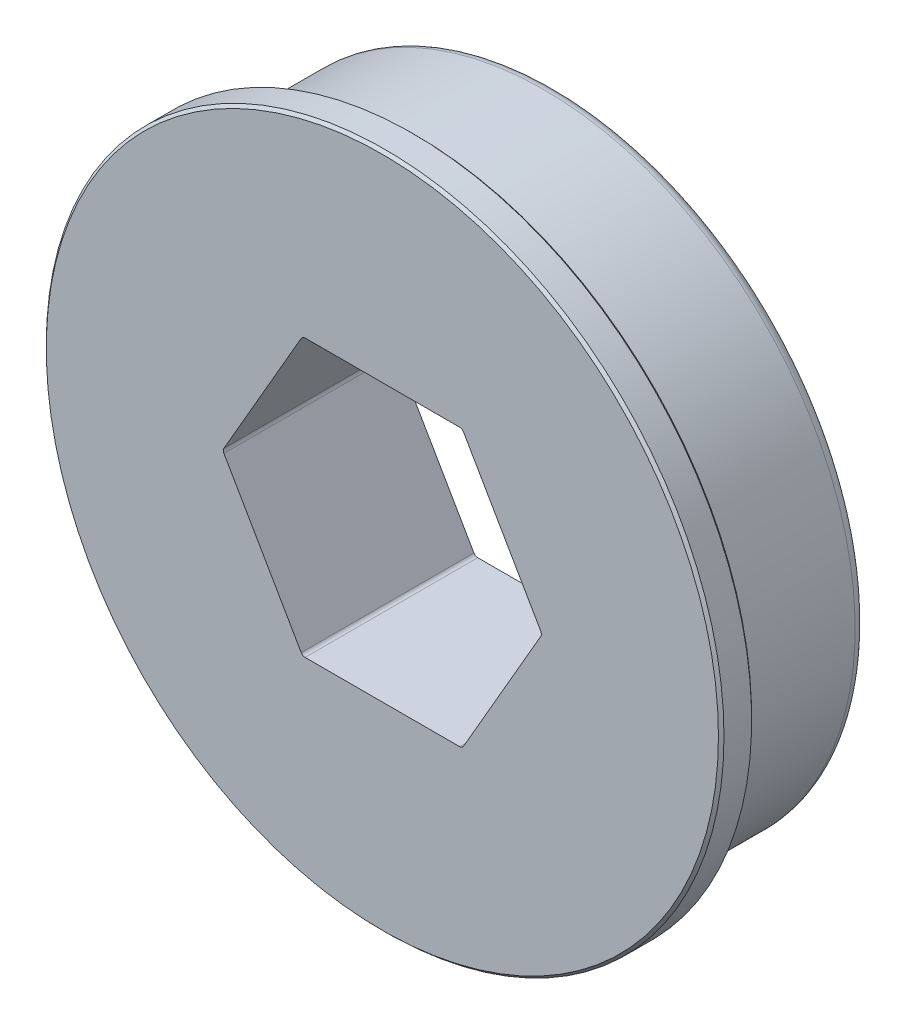
from build123d import *

# Parameters (mm, degrees)
CUT_EXTRUDE1_DEPTH = 24.386199605
CHAMFER1_SIZE      = 0.127
FILLET1_R          = 0.2032
FILLET2_R          = 0.508


with BuildPart() as part:
    # Sketch1 → Revolve1 (revolve)
    with BuildSketch(Plane.XZ):
        Polygon((15.5575, 7.92734), (0, 7.92734), (0, 0), (14.2875, 0), (14.2875, 5.89534), (13.97, 5.89534), (13.97, 6.40334), (15.5575, 6.40334), align=None)
    revolve(axis=Axis((0, 0, 7.92734), (0, 0, -1)))

    # Sketch2 → Cut-Extrude1 (cut, through all)
    with BuildSketch(Plane(origin=(0, 0, 0), x_dir=(-1, 0, 0), z_dir=(0, 0, -1))):
        Polygon((3.666174209, 6.35), (-3.666174209, 6.35), (-7.332348419, 0), (-3.666174209, -6.35), (3.666174209, -6.35), (7.332348419, 0), align=None)
    extrude(amount=-CUT_EXTRUDE1_DEPTH, mode=Mode.SUBTRACT)

    # Chamfer1
    chamfer1_edges = [part.edges().sort_by_distance(p)[0] for p in [
        (-15.5575, 0, 7.92734),
        (-15.5575, 0, 6.40334),
    ]]
    chamfer(chamfer1_edges, length=CHAMFER1_SIZE)

    # Fillet1
    fillet1_edges = [part.edges().sort_by_distance(p)[0] for p in [
        (-3.666174209, -6.35, 3.96367),
        (7.332348419, 0, 3.96367),
        (-7.332348419, 0, 3.96367),
        (-3.666174209, 6.35, 3.96367),
        (3.666174209, -6.35, 3.96367),
        (3.666174209, 6.35, 3.96367),
    ]]
    fillet(fillet1_edges, radius=FILLET1_R)

    # Fillet2
    fillet2_edges = [part.edges().sort_by_distance(p)[0] for p in [
        (-14.2875, 0, 0),
    ]]
    fillet(fillet2_edges, radius=FILLET2_R)


solid = part.part
